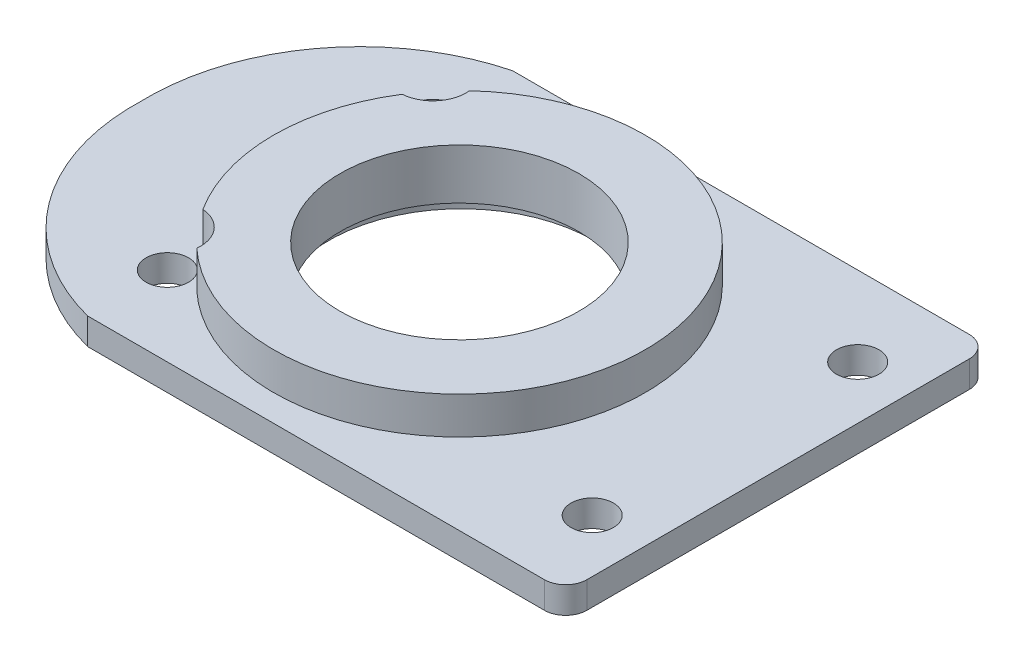
from build123d import *

# Parameters (mm, degrees)
SKETCH1_W               = 76.2
SKETCH1_H               = 50.8
SKETCH1_R               = 14.2748
BOSS_EXTRUDE1_DEPTH     = 3.175
SKETCH2_R               = 22.225
BOSS_EXTRUDE2_DEPTH     = 4.445
SKETCH3_R               = 14.2748
CUT_EXTRUDE1_DEPTH      = 92.688810795
SKETCH4_R               = 15.8623
CUT_EXTRUDE2_DEPTH      = 1.6002
FILLET2_R               = 2.54
CUT_EXTRUDE3_DEPTH      = 92.688810795
CUT_EXTRUDE3_DEPTH_BACK = 92.688810795
SKETCH5_R               = 2.54
CUT_EXTRUDE4_DEPTH      = 92.688810795
SKETCH7_R               = 3.96875
CUT_EXTRUDE5_DEPTH      = 92.688810795
SKETCH9_R               = 3.96875
CUT_EXTRUDE6_DEPTH      = 92.688810795


with BuildPart() as part:
    # Sketch1 → Boss-Extrude1 (new body)
    with BuildSketch(Plane(origin=(0, 0, 0), x_dir=(1, 0, 0), z_dir=(0, 1, 0))):
        with Locations((38.1, 25.4)):
            Rectangle(SKETCH1_W, SKETCH1_H)
        with Locations((38.1, 25.4)):
            Circle(SKETCH1_R, mode=Mode.SUBTRACT)
    extrude(amount=BOSS_EXTRUDE1_DEPTH)

    # Sketch2 → Boss-Extrude2 (add)
    with BuildSketch(Plane(origin=(0, 3.175, 0), x_dir=(1, 0, 0), z_dir=(0, 1, 0))):
        with Locations((38.1, 25.4)):
            Circle(SKETCH2_R)
    extrude(amount=BOSS_EXTRUDE2_DEPTH)

    # Sketch3 → Cut-Extrude1 (cut, through all)
    with BuildSketch(Plane.XZ.offset(-3.175)):
        with Locations((38.1, -25.4)):
            Circle(SKETCH3_R)
    extrude(amount=-CUT_EXTRUDE1_DEPTH, mode=Mode.SUBTRACT)

    # Sketch4 → Cut-Extrude2 (cut)
    with BuildSketch(Plane(origin=(0, 0, 0), x_dir=(-1, 0, 0), z_dir=(0, -1, 0))):
        with Locations((-38.332507849, 25.4)):
            Circle(SKETCH4_R)
    extrude(amount=-CUT_EXTRUDE2_DEPTH, mode=Mode.SUBTRACT)

    # Fillet2
    fillet2_edges = [part.edges().sort_by_distance(p)[0] for p in [
        (0, 1.5875, -50.8),
        (76.2, 1.5875, -50.8),
        (0, 1.5875, 0),
        (76.2, 1.5875, 0),
    ]]
    fillet(fillet2_edges, radius=FILLET2_R)

    # Sketch5 → Cut-Extrude3 (cut, two sides: drawn at the far end of the back side and taken through both)
    with BuildSketch(Plane(origin=(0, 3.175, 0), x_dir=(1, 0, 0), z_dir=(0, 1, 0)).offset(-CUT_EXTRUDE3_DEPTH_BACK)):
        with Locations((69.85, 41.275)):
            Circle(SKETCH5_R)
        with Locations((69.85, 9.525)):
            Circle(SKETCH5_R)
        with Locations((19.05, 9.525)):
            Circle(SKETCH5_R)
        with Locations((19.05, 41.275)):
            Circle(SKETCH5_R)
    extrude(amount=CUT_EXTRUDE3_DEPTH + CUT_EXTRUDE3_DEPTH_BACK, mode=Mode.SUBTRACT)

    # Sketch6 → Cut-Extrude4 (cut, through all)
    with BuildSketch(Plane(origin=(0, 3.175, 0), x_dir=(1, 0, 0), z_dir=(0, 1, 0))):
        with BuildLine():
            Line((0, 48.26), (0, 27.006557626))
            ThreePointArc((0, 27.006557626), (5.559426271, 42.078278813), (19.05, 50.8))
            Line((19.05, 50.8), (2.54, 50.8))
            ThreePointArc((2.54, 50.8), (0.743948776, 50.056051224), (0, 48.26))
        make_face()
        with BuildLine():
            Line((2.54, 0), (19.05, 0))
            ThreePointArc((19.05, 0), (5.559426271, 8.721721187), (0, 23.793442374))
            Line((0, 23.793442374), (0, 2.54))
            ThreePointArc((0, 2.54), (0.743948776, 0.743948776), (2.54, 0))
        make_face()
    extrude(amount=-CUT_EXTRUDE4_DEPTH, mode=Mode.SUBTRACT)

    # Sketch7 → Cut-Extrude5 (cut, through all)
    with BuildSketch(Plane(origin=(0, 3.175, 0), x_dir=(1, 0, 0), z_dir=(0, 1, 0))):
        with Locations((19.05, 9.525)):
            Circle(SKETCH7_R)
    extrude(amount=CUT_EXTRUDE5_DEPTH, mode=Mode.SUBTRACT)

    # Sketch9 → Cut-Extrude6 (cut, through all)
    with BuildSketch(Plane(origin=(0, 3.175, 0), x_dir=(1, 0, 0), z_dir=(0, 1, 0))):
        with Locations((19.05, 41.275)):
            Circle(SKETCH9_R)
    extrude(amount=CUT_EXTRUDE6_DEPTH, mode=Mode.SUBTRACT)


solid = part.part
